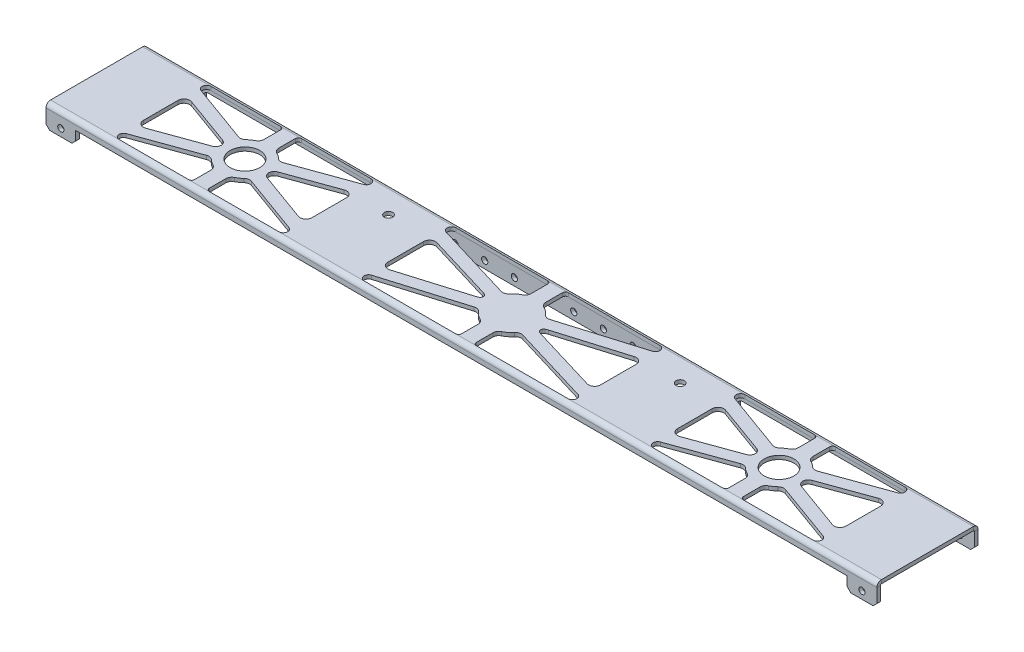
from build123d import *

# Parameters (mm, degrees)
SKETCH1_W                = 711.2
SKETCH1_H                = 78.74
BOSS_EXTRUDE1_DEPTH      = 3.175
EDGE_FLANGE1_DEPTH       = 711.2
EDGE_FLANGE2_DEPTH       = 711.2
SKETCH14_R               = 2.667
UPPER_FLANGE_HP_DEPTH    = 717.630616581
CUT_EXTRUDE7_START       = -3.175
CUT_EXTRUDE7_OUTLINE_W   = 660.4
CUT_EXTRUDE7_OUTLINE_H   = 20.875
CUT_EXTRUDE7_OUTLINE_R   = 2.667
CUT_EXTRUDE7_DEPTH       = 3.937
CHAMFER1_SIZE            = 3.175
SKETCH22_W               = 3.175
SKETCH22_H               = 11.938
BOSS_EXTRUDE2_DEPTH      = 660.4
SKETCH23_W               = 660.4
SKETCH23_H               = 7.9375
CUT_EXTRUDE8_DEPTH       = 127
SKETCH24_R               = 12.7
CUT_EXTRUDE9_DEPTH       = 717.165443144
SKETCH25_R               = 3.571875
CUT_EXTRUDE10_DEPTH      = 254
SKETCH27_W               = 152.4
SKETCH27_H               = 12.100443779
SKETCH27_R               = 2.667
CUT_EXTRUDE12_DEPTH      = 10.16
FILLET1_R                = 5.08
CHAMFER2_SIZE            = 2.54
CUT_EXTRUDE13_DEPTH      = 717.24285604
CUT_EXTRUDE13_DEPTH_BACK = 717.24285604
FILLET10_R               = 3.81
CUT_EXTRUDE14_START      = -10.16
CUT_EXTRUDE14_DEPTH      = 10.16
FILLET11_R               = 5.08
FILLET12_R               = 12.7
FILLET13_R               = 2.54
FILLET14_R               = 5.08
FILLET15_R               = 2.54


# Read off the part's stored shape, not the designer's step: Cut-Extrude7
# Sheet-metal steps are written as plain solids
with BuildPart() as part:
    # Sketch1 → Boss-Extrude1 (new body)
    with BuildSketch(Plane(origin=(0, 0, 0), x_dir=(1, 0, 0), z_dir=(0, 1, 0))):
        with Locations((355.6, 39.37)):
            Rectangle(SKETCH1_W, SKETCH1_H)
    extrude(amount=BOSS_EXTRUDE1_DEPTH)

    # Edge-Flange1 section (across the edge) → Edge-Flange1 (add)
    with BuildSketch(Plane(origin=(711.2, 0, 0.762), x_dir=(0, 0, -1), z_dir=(-1, 0, 0))):
        with BuildLine():
            Line((-3.175, 0.762), (-3.175, 15.875))
            Line((-3.175, 15.875), (0, 15.875))
            Line((0, 15.875), (0, 0.762))
            ThreePointArc((0, 0.762), (0.223184633, 0.223184633), (0.762, 0))
            Line((0.762, 0), (0.762, -3.175))
            ThreePointArc((0.762, -3.175), (-2.021879398, -2.021879398), (-3.175, 0.762))
        make_face()
    extrude(amount=EDGE_FLANGE1_DEPTH)

    # Edge-Flange2 section (across the edge) → Edge-Flange2 (add)
    with BuildSketch(Plane(origin=(0, 0, -79.502), x_dir=(0, 0, 1), z_dir=(1, 0, 0))):
        with BuildLine():
            Line((-3.175, 0.762), (-3.175, 15.875))
            Line((-3.175, 15.875), (0, 15.875))
            Line((0, 15.875), (0, 0.762))
            ThreePointArc((0, 0.762), (0.223184633, 0.223184633), (0.762, 0))
            Line((0.762, 0), (0.762, -3.175))
            ThreePointArc((0.762, -3.175), (-2.021879398, -2.021879398), (-3.175, 0.762))
        make_face()
    extrude(amount=EDGE_FLANGE2_DEPTH)

    # Sketch14 → upper flange HP (cut, through all)
    with BuildSketch(Plane(origin=(0, 0, -82.677), x_dir=(-1, 0, 0), z_dir=(0, 0, -1))):
        with Locations(Location((-12.7, -9.525, 0), (0, 0, 90))):
            Circle(SKETCH14_R)
        with Locations(Location((-38.1, -9.525, 0), (0, 0, 90))):
            Circle(SKETCH14_R)
        with Locations(Location((-63.5, -9.525, 0), (0, 0, 90))):
            Circle(SKETCH14_R)
        with Locations(Location((-88.9, -9.525, 0), (0, 0, 90))):
            Circle(SKETCH14_R)
        with Locations(Location((-114.3, -9.525, 0), (0, 0, 90))):
            Circle(SKETCH14_R)
        with Locations(Location((-139.7, -9.525, 0), (0, 0, 90))):
            Circle(SKETCH14_R)
        with Locations(Location((-165.1, -9.525, 0), (0, 0, 90))):
            Circle(SKETCH14_R)
        with Locations(Location((-190.5, -9.525, 0), (0, 0, 90))):
            Circle(SKETCH14_R)
        with Locations(Location((-215.9, -9.525, 0), (0, 0, 90))):
            Circle(SKETCH14_R)
        with Locations(Location((-241.3, -9.525, 0), (0, 0, 90))):
            Circle(SKETCH14_R)
        with Locations(Location((-266.7, -9.525, 0), (0, 0, 90))):
            Circle(SKETCH14_R)
        with Locations(Location((-292.1, -9.525, 0), (0, 0, 90))):
            Circle(SKETCH14_R)
        with Locations(Location((-317.5, -9.525, 0), (0, 0, 90))):
            Circle(SKETCH14_R)
        with Locations(Location((-342.9, -9.525, 0), (0, 0, 90))):
            Circle(SKETCH14_R)
        with Locations(Location((-368.3, -9.525, 0), (0, 0, 90))):
            Circle(SKETCH14_R)
        with Locations(Location((-393.7, -9.525, 0), (0, 0, 90))):
            Circle(SKETCH14_R)
        with Locations(Location((-419.1, -9.525, 0), (0, 0, 90))):
            Circle(SKETCH14_R)
        with Locations(Location((-444.5, -9.525, 0), (0, 0, 90))):
            Circle(SKETCH14_R)
        with Locations(Location((-469.9, -9.525, 0), (0, 0, 90))):
            Circle(SKETCH14_R)
        with Locations(Location((-495.3, -9.525, 0), (0, 0, 90))):
            Circle(SKETCH14_R)
        with Locations(Location((-520.7, -9.525, 0), (0, 0, 90))):
            Circle(SKETCH14_R)
        with Locations(Location((-546.1, -9.525, 0), (0, 0, 90))):
            Circle(SKETCH14_R)
        with Locations(Location((-571.5, -9.525, 0), (0, 0, 90))):
            Circle(SKETCH14_R)
        with Locations(Location((-596.9, -9.525, 0), (0, 0, 90))):
            Circle(SKETCH14_R)
        with Locations(Location((-622.3, -9.525, 0), (0, 0, 90))):
            Circle(SKETCH14_R)
        with Locations(Location((-647.7, -9.525, 0), (0, 0, 90))):
            Circle(SKETCH14_R)
        with Locations(Location((-673.1, -9.525, 0), (0, 0, 90))):
            Circle(SKETCH14_R)
        with Locations(Location((-698.5, -9.525, 0), (0, 0, 90))):
            Circle(SKETCH14_R)
        with Locations((-723.9, -9.525)):
            Circle(SKETCH14_R)
        with Locations((-749.3, -9.525)):
            Circle(SKETCH14_R)
        with Locations((-774.7, -9.525)):
            Circle(SKETCH14_R)
        with Locations((-800.1, -9.525)):
            Circle(SKETCH14_R)
    extrude(amount=-UPPER_FLANGE_HP_DEPTH, mode=Mode.SUBTRACT)

    # Cut-Extrude7 outline → Cut-Extrude7 (cut)
    with BuildSketch(Plane(origin=(0, 0, 0.762), x_dir=(-1, 0, 0), z_dir=(0, 0, -1)).offset(CUT_EXTRUDE7_START)):
        with Locations((-355.6, -5.4375)):
            Rectangle(CUT_EXTRUDE7_OUTLINE_W, CUT_EXTRUDE7_OUTLINE_H)
        with Locations((-673.1, -9.525)):
            Circle(CUT_EXTRUDE7_OUTLINE_R, mode=Mode.SUBTRACT)
        with Locations((-647.7, -9.525)):
            Circle(CUT_EXTRUDE7_OUTLINE_R, mode=Mode.SUBTRACT)
        with Locations((-622.3, -9.525)):
            Circle(CUT_EXTRUDE7_OUTLINE_R, mode=Mode.SUBTRACT)
        with Locations((-596.9, -9.525)):
            Circle(CUT_EXTRUDE7_OUTLINE_R, mode=Mode.SUBTRACT)
        with Locations((-571.5, -9.525)):
            Circle(CUT_EXTRUDE7_OUTLINE_R, mode=Mode.SUBTRACT)
        with Locations((-546.1, -9.525)):
            Circle(CUT_EXTRUDE7_OUTLINE_R, mode=Mode.SUBTRACT)
        with Locations((-520.7, -9.525)):
            Circle(CUT_EXTRUDE7_OUTLINE_R, mode=Mode.SUBTRACT)
        with Locations((-495.3, -9.525)):
            Circle(CUT_EXTRUDE7_OUTLINE_R, mode=Mode.SUBTRACT)
        with Locations((-469.9, -9.525)):
            Circle(CUT_EXTRUDE7_OUTLINE_R, mode=Mode.SUBTRACT)
        with Locations((-444.5, -9.525)):
            Circle(CUT_EXTRUDE7_OUTLINE_R, mode=Mode.SUBTRACT)
        with Locations((-419.1, -9.525)):
            Circle(CUT_EXTRUDE7_OUTLINE_R, mode=Mode.SUBTRACT)
        with Locations((-393.7, -9.525)):
            Circle(CUT_EXTRUDE7_OUTLINE_R, mode=Mode.SUBTRACT)
        with Locations((-368.3, -9.525)):
            Circle(CUT_EXTRUDE7_OUTLINE_R, mode=Mode.SUBTRACT)
        with Locations((-342.9, -9.525)):
            Circle(CUT_EXTRUDE7_OUTLINE_R, mode=Mode.SUBTRACT)
        with Locations((-317.5, -9.525)):
            Circle(CUT_EXTRUDE7_OUTLINE_R, mode=Mode.SUBTRACT)
        with Locations((-292.1, -9.525)):
            Circle(CUT_EXTRUDE7_OUTLINE_R, mode=Mode.SUBTRACT)
        with Locations((-266.7, -9.525)):
            Circle(CUT_EXTRUDE7_OUTLINE_R, mode=Mode.SUBTRACT)
        with Locations((-241.3, -9.525)):
            Circle(CUT_EXTRUDE7_OUTLINE_R, mode=Mode.SUBTRACT)
        with Locations((-215.9, -9.525)):
            Circle(CUT_EXTRUDE7_OUTLINE_R, mode=Mode.SUBTRACT)
        with Locations((-190.5, -9.525)):
            Circle(CUT_EXTRUDE7_OUTLINE_R, mode=Mode.SUBTRACT)
        with Locations((-165.1, -9.525)):
            Circle(CUT_EXTRUDE7_OUTLINE_R, mode=Mode.SUBTRACT)
        with Locations((-139.7, -9.525)):
            Circle(CUT_EXTRUDE7_OUTLINE_R, mode=Mode.SUBTRACT)
        with Locations((-114.3, -9.525)):
            Circle(CUT_EXTRUDE7_OUTLINE_R, mode=Mode.SUBTRACT)
        with Locations((-88.9, -9.525)):
            Circle(CUT_EXTRUDE7_OUTLINE_R, mode=Mode.SUBTRACT)
        with Locations((-63.5, -9.525)):
            Circle(CUT_EXTRUDE7_OUTLINE_R, mode=Mode.SUBTRACT)
        with Locations((-38.1, -9.525)):
            Circle(CUT_EXTRUDE7_OUTLINE_R, mode=Mode.SUBTRACT)
    extrude(amount=CUT_EXTRUDE7_DEPTH, mode=Mode.SUBTRACT)

    # Chamfer1
    chamfer1_edges = [part.edges().sort_by_distance(p)[0] for p in [
        (711.2, -15.875, 2.3495),
        (0, -15.875, 2.3495),
        (25.4, -15.875, 2.3495),
        (685.8, -15.875, 2.3495),
        (0, -15.875, -81.0895),
        (711.2, -15.875, -81.0895),
    ]]
    chamfer(chamfer1_edges, length=CHAMFER1_SIZE)

    # Sketch22 → Boss-Extrude2 (add)
    with BuildSketch(Plane.ZY.offset(-685.8)):
        with BuildLine():
            ThreePointArc((0, 0), (0.538815367, -0.223184633), (0.762, -0.762))
            Line((0.762, -0.762), (3.937, -0.762))
            ThreePointArc((3.937, -0.762), (2.783879398, 2.021879398), (0, 3.175))
            Line((0, 3.175), (0, 0))
        make_face()
        with Locations((2.3495, -6.731)):
            Rectangle(SKETCH22_W, SKETCH22_H)
    extrude(amount=BOSS_EXTRUDE2_DEPTH)

    # Sketch23 → Cut-Extrude8 (cut)
    with BuildSketch(Plane(origin=(0, 0, 0.762), x_dir=(-1, 0, 0), z_dir=(0, 0, -1))):
        with Locations((-355.6, -8.73125)):
            Rectangle(SKETCH23_W, SKETCH23_H)
    extrude(amount=-CUT_EXTRUDE8_DEPTH, mode=Mode.SUBTRACT)

    # Sketch24 → Cut-Extrude9 (cut, through all)
    with BuildSketch(Plane(origin=(0, 0, 0), x_dir=(-1, 0, 0), z_dir=(0, -1, 0))):
        with Locations(Location((-584.2, 39.37, 0), (0, 0, 90))):
            Circle(SKETCH24_R)
        with Locations(Location((-127, 39.37, 0), (0, 0, 90))):
            Circle(SKETCH24_R)
    extrude(amount=-CUT_EXTRUDE9_DEPTH, mode=Mode.SUBTRACT)

    # Sketch25 → Cut-Extrude10 (cut)
    with BuildSketch(Plane.XZ):
        with Locations(Location((479.4, -59.502, 0), (0, 0, 270))):
            Circle(SKETCH25_R)
        with Locations(Location((229.79920635, -59.502, 0), (0, 0, 270))):
            Circle(SKETCH25_R)
    extrude(amount=-CUT_EXTRUDE10_DEPTH, mode=Mode.SUBTRACT)

    # Sketch27 → Cut-Extrude12 (cut)
    # profile 1 of 2: a face of its own
    with BuildSketch(Plane(origin=(0, 0, -82.677), x_dir=(-1, 0, 0), z_dir=(0, 0, -1))):
        with Locations((-584.2, -9.824778111)):
            Rectangle(SKETCH27_W, SKETCH27_H)
        with Locations((-647.7, -9.525)):
            Circle(SKETCH27_R, mode=Mode.SUBTRACT)
        with Locations((-622.3, -9.525)):
            Circle(SKETCH27_R, mode=Mode.SUBTRACT)
        with Locations((-596.9, -9.525)):
            Circle(SKETCH27_R, mode=Mode.SUBTRACT)
        with Locations((-571.5, -9.525)):
            Circle(SKETCH27_R, mode=Mode.SUBTRACT)
        with Locations((-546.1, -9.525)):
            Circle(SKETCH27_R, mode=Mode.SUBTRACT)
        with Locations((-520.7, -9.525)):
            Circle(SKETCH27_R, mode=Mode.SUBTRACT)
    # profile 2 of 2: a face of its own
    with BuildSketch(Plane(origin=(0, 0, -82.677), x_dir=(-1, 0, 0), z_dir=(0, 0, -1))):
        with Locations((-127, -9.824778111)):
            Rectangle(SKETCH27_W, SKETCH27_H)
    extrude(amount=-CUT_EXTRUDE12_DEPTH, mode=Mode.SUBTRACT)

    # Fillet1
    fillet1_edges = [part.edges().sort_by_distance(p)[0] for p in [
        (660.4, -3.774556221, -81.0895),
        (508, -3.774556221, -81.0895),
        (203.2, -3.774556221, -81.0895),
        (50.8, -3.774556221, -81.0895),
    ]]
    fillet(fillet1_edges, radius=FILLET1_R)

    # Chamfer2
    chamfer2_edges = [part.edges().sort_by_distance(p)[0] for p in [
        (50.8, -15.875, -81.0895),
        (203.2, -15.875, -81.0895),
        (660.4, -15.875, -81.0895),
        (508, -15.875, -81.0895),
    ]]
    chamfer(chamfer2_edges, length=CHAMFER2_SIZE)

    # Sketch29 → Cut-Extrude13 (cut, two sides: drawn at the far end of the back side and taken through both)
    with BuildSketch(Plane(origin=(0, 3.175, 0), x_dir=(1, 0, 0), z_dir=(0, 1, 0)).offset(-CUT_EXTRUDE13_DEPTH_BACK)):
        with BuildLine():
            Line((338.22619972, 28.831809271), (242.49920635, 0))
            Line((242.49920635, 0), (349.25, 0))
            Line((349.25, 0), (349.25, 20.067671125))
            ThreePointArc((349.25, 20.067671125), (342.954557964, 23.464177302), (338.22619972, 28.831809271))
        make_face()
        with BuildLine():
            Line((349.25, 78.74), (242.49920635, 78.74))
            Line((242.49920635, 78.74), (338.22619972, 49.908190729))
            ThreePointArc((338.22619972, 49.908190729), (342.954557964, 55.275822698), (349.25, 58.672328875))
            Line((349.25, 58.672328875), (349.25, 78.74))
        make_face()
        with BuildLine():
            Line((111.005334269, 26.837120516), (36.90079357, 0))
            Line((36.90079357, 0), (120.65, 0))
            Line((120.65, 0), (120.65, 20.067671125))
            ThreePointArc((120.65, 20.067671125), (115.326209574, 22.737952108), (111.005334269, 26.837120516))
        make_face()
        with BuildLine():
            Line((133.35, 20.067671125), (133.35, 0))
            Line((133.35, 0), (217.09920635, 0))
            Line((217.09920635, 0), (142.994665731, 26.837120516))
            ThreePointArc((142.994665731, 26.837120516), (138.673790426, 22.737952108), (133.35, 20.067671125))
        make_face()
        with BuildLine():
            Line((217.09920635, 78.74), (133.35, 78.74))
            Line((133.35, 78.74), (133.35, 58.672328875))
            ThreePointArc((133.35, 58.672328875), (138.673790426, 56.002047892), (142.994665731, 51.902879484))
            Line((142.994665731, 51.902879484), (217.09920635, 78.74))
        make_face()
        with BuildLine():
            Line((120.65, 78.74), (36.90079357, 78.74))
            Line((36.90079357, 78.74), (111.005334269, 51.902879484))
            ThreePointArc((111.005334269, 51.902879484), (115.326209574, 56.002047892), (120.65, 58.672328875))
            Line((120.65, 58.672328875), (120.65, 78.74))
        make_face()
        with BuildLine():
            Line((372.97380028, 49.908190729), (468.70079365, 78.74))
            Line((468.70079365, 78.74), (361.95, 78.74))
            Line((361.95, 78.74), (361.95, 58.672328875))
            ThreePointArc((361.95, 58.672328875), (368.245442036, 55.275822698), (372.97380028, 49.908190729))
        make_face()
        with BuildLine():
            Line((494.10079365, 0), (577.85, 0))
            Line((577.85, 0), (577.85, 20.067671125))
            ThreePointArc((577.85, 20.067671125), (572.526209574, 22.737952108), (568.205334269, 26.837120516))
            Line((568.205334269, 26.837120516), (494.10079365, 0))
        make_face()
        with BuildLine():
            Line((590.55, 20.067671125), (590.55, 0))
            Line((590.55, 0), (674.29920643, 0))
            Line((674.29920643, 0), (600.194665731, 26.837120516))
            ThreePointArc((600.194665731, 26.837120516), (595.873790426, 22.737952108), (590.55, 20.067671125))
        make_face()
        with BuildLine():
            Line((674.29920643, 78.74), (590.55, 78.74))
            Line((590.55, 78.74), (590.55, 58.672328875))
            ThreePointArc((590.55, 58.672328875), (595.873790426, 56.002047892), (600.194665731, 51.902879484))
            Line((600.194665731, 51.902879484), (674.29920643, 78.74))
        make_face()
        with BuildLine():
            Line((577.85, 58.672328875), (577.85, 78.74))
            Line((577.85, 78.74), (494.10079365, 78.74))
            Line((494.10079365, 78.74), (568.205334269, 51.902879484))
            ThreePointArc((568.205334269, 51.902879484), (572.526209574, 56.002047892), (577.85, 58.672328875))
        make_face()
        with BuildLine():
            Line((468.70079365, 0), (372.97380028, 28.831809271))
            ThreePointArc((372.97380028, 28.831809271), (368.245442036, 23.464177302), (361.95, 20.067671125))
            Line((361.95, 20.067671125), (361.95, 0))
            Line((361.95, 0), (468.70079365, 0))
        make_face()
    extrude(amount=CUT_EXTRUDE13_DEPTH + CUT_EXTRUDE13_DEPTH_BACK, mode=Mode.SUBTRACT)

    # Fillet10
    fillet10_edges = [part.edges().sort_by_distance(p)[0] for p in [
        (242.49920635, 1.5875, -78.74),
        (468.70079365, 1.5875, 0),
        (468.70079365, 1.5875, -78.74),
        (494.10079365, 1.5875, -78.74),
        (217.09920635, 1.5875, -78.74),
        (217.09920635, 1.5875, 0),
        (36.90079357, 1.5875, 0),
        (242.49920635, 1.5875, 0),
        (674.29920643, 1.5875, -78.74),
        (674.29920643, 1.5875, 0),
        (494.10079365, 1.5875, 0),
        (36.90079357, 1.5875, -78.74),
    ]]
    fillet(fillet10_edges, radius=FILLET10_R)

    # Sketch30 → Cut-Extrude14 (cut)
    with BuildSketch(Plane(origin=(0, 3.175, 0), x_dir=(1, 0, 0), z_dir=(0, 1, 0)).offset(CUT_EXTRUDE14_START)):
        with BuildLine():
            Line((199.142324219, 17.308866397), (199.142324219, 61.431133603))
            Line((199.142324219, 61.431133603), (147.066186859, 42.571647226))
            ThreePointArc((147.066186859, 42.571647226), (147.32, 39.37), (147.066186859, 36.168352774))
            Line((147.066186859, 36.168352774), (199.142324219, 17.308866397))
        make_face()
        with BuildLine():
            ThreePointArc((335.296145106, 40.179861994), (335.28, 39.37), (335.296145106, 38.560138006))
            Line((335.296145106, 38.560138006), (264.591025914, 17.264613731))
            Line((264.591025914, 17.264613731), (264.591025914, 61.475386269))
            Line((264.591025914, 61.475386269), (335.296145106, 40.179861994))
        make_face()
        with BuildLine():
            ThreePointArc((375.903854894, 38.560138006), (375.92, 39.37), (375.903854894, 40.179861994))
            Line((375.903854894, 40.179861994), (446.608974086, 61.475386269))
            Line((446.608974086, 61.475386269), (446.608974086, 17.264613731))
            Line((446.608974086, 17.264613731), (375.903854894, 38.560138006))
        make_face()
        with BuildLine():
            Line((512.046367011, 17.304770901), (564.133813141, 36.168352774))
            ThreePointArc((564.133813141, 36.168352774), (563.88, 39.37), (564.133813141, 42.571647226))
            Line((564.133813141, 42.571647226), (512.011095825, 61.448002636))
            Line((512.011095825, 61.448002636), (512.046367011, 17.304770901))
        make_face()
        with BuildLine():
            ThreePointArc((604.266186859, 36.168352774), (604.52, 39.37), (604.266186859, 42.571647226))
            Line((604.266186859, 42.571647226), (656.388904233, 61.448002636))
            Line((656.388904233, 61.448002636), (656.353633047, 17.304770901))
            Line((656.353633047, 17.304770901), (604.266186859, 36.168352774))
        make_face()
        with BuildLine():
            Line((54.857675723, 61.431133604), (106.933813141, 42.571647226))
            ThreePointArc((106.933813141, 42.571647226), (106.68, 39.37), (106.933813141, 36.168352774))
            Line((106.933813141, 36.168352774), (54.857675723, 17.308866396))
            Line((54.857675723, 17.308866396), (54.857675723, 61.431133604))
        make_face()
    extrude(amount=CUT_EXTRUDE14_DEPTH, mode=Mode.SUBTRACT)

    # Fillet11
    # the kernel refuses this fillet: 5.08 mm, written as the material it adds along each edge
    with BuildSketch(Plane(origin=(106.933813141, 0, -42.571647226), x_dir=(-0.9402408036719843, 0, -0.3405102511089219), z_dir=(0, 1, 0))) as fillet11_piece_1:
        with BuildLine():
            CenterArc((3.831555696, 5.08), FILLET11_R, 200.517233147, 69.482766853)
            ThreePointArc((-0.926203715, 3.299515407), (-0.393418231, 1.669318525), (0, 0))
            Line((0, 0), (3.831555696, 0))
        make_face()
    extrude(amount=3.175)
    with BuildSketch(Plane(origin=(106.933813141, 0, -36.168352774), x_dir=(-0.9402408036719846, 0, 0.340510251108921), z_dir=(0, 1, 0))) as fillet11_piece_2:
        with BuildLine():
            CenterArc((3.831555696, -5.08), FILLET11_R, 90, 69.482766853)
            ThreePointArc((-0.926203715, -3.299515407), (-0.393418231, -1.669318525), (0, 0))
            Line((0, 0), (3.831555696, 0))
        make_face()
    extrude(amount=3.175)
    with BuildSketch(Plane(origin=(604.266186859, 0, -36.168352774), x_dir=(0.07372652031943779, 0, -0.9972784968109898), z_dir=(0, 1, 0))) as fillet11_piece_3:
        with BuildLine():
            CenterArc((3.855428548, -5.061905744), FILLET11_R, 94.837323485, 69.482766853)
            Line((-1.035527234, -3.688970371), (0, 0))
            ThreePointArc((0, 0), (1.713523799, -0.072377024), (3.427047598, 0))
        make_face()
    extrude(amount=3.175)
    with BuildSketch(Plane(origin=(604.266186859, 0, -42.571647226), x_dir=(0.07372652031943824, 0, 0.9972784968109898), z_dir=(0, 1, 0))) as fillet11_piece_4:
        with BuildLine():
            CenterArc((3.855428548, 5.061905744), FILLET11_R, 195.679909662, 69.482766853)
            Line((-1.035527234, 3.688970371), (0, 0))
            ThreePointArc((0, 0), (1.713523799, 0.072377024), (3.427047598, 0))
        make_face()
    extrude(amount=3.175)
    with BuildSketch(Plane(origin=(564.133813141, 0, -42.571647226), x_dir=(-0.07372652035756005, 0, 0.9972784968081715), z_dir=(0, 1, 0)), Plane(origin=(147.066186859, 0, -36.168352774), x_dir=(0.0737265203575437, 0, -0.9972784968081727), z_dir=(0, 1, 0))) as fillet11_piece_5:
        with BuildLine():
            CenterArc((3.855428547, -5.061905744), FILLET11_R, 94.837323484, 69.482766837)
            Line((-1.035527235, -3.68897037), (0, 0))
            ThreePointArc((0, 0), (1.713523799, -0.072377024), (3.427047597, 0))
        make_face()
    extrude(amount=3.175)
    with BuildSketch(Plane(origin=(564.133813141, 0, -36.168352774), x_dir=(-0.9402408035542927, 0, 0.34051025143390035), z_dir=(0, 1, 0)), Plane(origin=(147.066186859, 0, -42.571647226), x_dir=(0.9402408035542937, 0, -0.340510251433897), z_dir=(0, 1, 0))) as fillet11_piece_6:
        with BuildLine():
            CenterArc((3.831555695, -5.08), FILLET11_R, 90, 69.482766837)
            ThreePointArc((-0.926203716, -3.299515406), (-0.393418231, -1.669318525), (0, 0))
            Line((0, 0), (3.831555695, 0))
        make_face()
    extrude(amount=3.175)
    with BuildSketch(Plane(origin=(349.25, 3.175, -58.672328875), x_dir=(-0.9240342753920577, 0, 0.38230963615984737), z_dir=(0, -1, 0)), Plane(origin=(577.85, 3.175, -58.672328875), x_dir=(-0.9240342753920543, 0, 0.38230963615985536), z_dir=(0, -1, 0)), Plane(origin=(120.65, 0, -20.067671125), x_dir=(-0.9240342753920578, 0, -0.38230963615984703), z_dir=(0, 1, 0)), Plane(origin=(120.65, 3.175, -58.672328875), x_dir=(-0.9240342753920568, 0, 0.38230963615984936), z_dir=(0, -1, 0))) as fillet11_piece_7:
        with BuildLine():
            CenterArc((3.401659531, 5.065919916), FILLET11_R, 202.476820407, 63.25631605)
            Line((-1.292434588, 3.123786965), (0, 0))
            ThreePointArc((0, 0), (1.511848681, 0.056320335), (3.023697361, 0))
        make_face()
    extrude(amount=3.175)
    with BuildSketch(Plane(origin=(338.22619972, 3.175, -49.908190729), x_dir=(-0.9575126706850127, 0, -0.28839120215022984), z_dir=(0, -1, 0)), Plane(origin=(338.22619972, 0, -28.831809271), x_dir=(-0.9575126706850126, 0, 0.2883912021502296), z_dir=(0, 1, 0))) as fillet11_piece_8:
        with BuildLine():
            CenterArc((3.604729132, 5.08), FILLET11_R, 203.578178478, 66.421821522)
            ThreePointArc((-1.051167774, 3.048), (-0.465035318, 1.544881465), (0, 0))
            Line((0, 0), (3.604729132, 0))
        make_face()
    extrude(amount=3.175)
    with BuildSketch(Plane(origin=(361.95, 3.175, -20.067671125), x_dir=(0, 0, 1), z_dir=(0, -1, 0)), Plane(origin=(133.35, 0, -58.672328875), x_dir=(0, 0, -1), z_dir=(0, 1, 0)), Plane(origin=(133.35, 3.175, -20.067671125), x_dir=(0, 0, 1), z_dir=(0, -1, 0)), Plane(origin=(590.55, 3.175, -20.067671125), x_dir=(0, 0, 1), z_dir=(0, -1, 0))) as fillet11_piece_9:
        with BuildLine():
            CenterArc((3.380596421, -5.08), FILLET11_R, 90, 63.25631605)
            ThreePointArc((-1.155988638, -2.794), (-0.525952399, -1.418531807), (0, 0))
            Line((0, 0), (3.380596421, 0))
        make_face()
    extrude(amount=3.175)
    with BuildSketch(Plane(origin=(372.97380028, 3.175, -28.831809271), x_dir=(-0.5848091639445875, 0, 0.811170907864941), z_dir=(0, -1, 0)), Plane(origin=(372.97380028, 0, -49.908190729), x_dir=(-0.5848091639445875, 0, -0.811170907864941), z_dir=(0, 1, 0))) as fillet11_piece_10:
        with BuildLine():
            CenterArc((3.62718872, -5.063987964), FILLET11_R, 94.550333146, 66.421821522)
            Line((-1.1752413, -3.407767598), (0, 0))
            ThreePointArc((0, 0), (1.612083876, -0.064048144), (3.224167752, 0))
        make_face()
    extrude(amount=3.175)
    with BuildSketch(Plane(origin=(361.95, 3.175, -58.672328875), x_dir=(0, 0, -1), z_dir=(0, -1, 0)), Plane(origin=(590.55, 3.175, -58.672328875), x_dir=(0, 0, -1), z_dir=(0, -1, 0))) as fillet11_piece_11:
        with BuildLine():
            CenterArc((3.380596421, 5.08), FILLET11_R, 206.74368395, 63.25631605)
            ThreePointArc((-1.155988638, 2.794), (-0.525952399, 1.418531807), (0, 0))
            Line((0, 0), (3.380596421, 0))
        make_face()
    extrude(amount=3.175)
    with BuildSketch(Plane(origin=(568.205334269, 3.175, -51.902879484), x_dir=(-0.9402408035542952, 0, -0.34051025143389363), z_dir=(0, -1, 0)), Plane(origin=(568.205334269, 0, -26.837120516), x_dir=(-0.940240803554293, 0, 0.34051025143389974), z_dir=(0, 1, 0))) as fillet11_piece_12:
        with BuildLine():
            CenterArc((3.382769705, 5.08), FILLET11_R, 206.712308556, 63.287691444)
            ThreePointArc((-1.155066497, 2.796484594), (-0.525411471, 1.419770797), (0, 0))
            Line((0, 0), (3.382769705, 0))
        make_face()
    extrude(amount=3.175)
    with BuildSketch(Plane(origin=(142.994665731, 3.175, -51.902879484), x_dir=(-0.6736662366069149, 0, -0.7390357242081577), z_dir=(0, -1, 0))) as fillet11_piece_13:
        with BuildLine():
            CenterArc((3.403846355, 5.065901782), FILLET11_R, 202.442696888, 63.287691444)
            Line((-1.291403603, 3.126564826), (0, 0))
            ThreePointArc((0, 0), (1.512820602, 0.056392872), (3.025641205, 0))
        make_face()
    extrude(amount=3.175)
    with BuildSketch(Plane(origin=(142.994665731, 3.175, -26.837120516), x_dir=(-0.6736662366069162, 0, 0.7390357242081566), z_dir=(0, -1, 0))) as fillet11_piece_14:
        with BuildLine():
            CenterArc((3.403846355, -5.065901782), FILLET11_R, 94.269611668, 63.287691444)
            Line((-1.291403603, -3.126564826), (0, 0))
            ThreePointArc((0, 0), (1.512820602, -0.056392872), (3.025641205, 0))
        make_face()
    extrude(amount=3.175)
    with BuildSketch(Plane(origin=(111.005334269, 3.175, -26.837120516), x_dir=(-0.9402408036719839, 0, 0.34051025110892286), z_dir=(0, -1, 0))) as fillet11_piece_15:
        with BuildLine():
            CenterArc((3.382769703, -5.08), FILLET11_R, 90, 63.287691427)
            ThreePointArc((-1.155066497, -2.796484593), (-0.525411471, -1.419770797), (0, 0))
            Line((0, 0), (3.382769703, 0))
        make_face()
    extrude(amount=3.175)
    with BuildSketch(Plane(origin=(349.25, 3.175, -20.067671125), x_dir=(-0.9240342753920552, 0, -0.3823096361598533), z_dir=(0, -1, 0)), Plane(origin=(577.85, 3.175, -20.067671125), x_dir=(-0.9240342753920523, 0, -0.38230963615986036), z_dir=(0, -1, 0))) as fillet11_piece_16:
        with BuildLine():
            CenterArc((3.401659531, -5.065919916), FILLET11_R, 94.266863543, 63.25631605)
            Line((-1.292434588, -3.123786965), (0, 0))
            ThreePointArc((0, 0), (1.511848681, -0.056320335), (3.023697361, 0))
        make_face()
    extrude(amount=3.175)
    with BuildSketch(Plane(origin=(600.194665731, 0, -51.902879484), x_dir=(-0.673666236587871, 0, -0.7390357242255171), z_dir=(0, 1, 0)), Plane(origin=(600.194665731, 3.175, -26.837120516), x_dir=(-0.6736662365878722, 0, 0.7390357242255161), z_dir=(0, -1, 0))) as fillet11_piece_17:
        with BuildLine():
            CenterArc((3.403846354, -5.065901782), FILLET11_R, 94.269611666, 63.287691427)
            Line((-1.291403603, -3.126564824), (0, 0))
            ThreePointArc((0, 0), (1.512820602, -0.056392872), (3.025641204, 0))
        make_face()
    extrude(amount=3.175)
    with BuildSketch(Plane(origin=(111.005334269, 3.175, -51.902879484), x_dir=(-0.9402408036719846, 0, -0.34051025110892097), z_dir=(0, -1, 0))) as fillet11_piece_18:
        with BuildLine():
            CenterArc((3.382769703, 5.08), FILLET11_R, 206.712308573, 63.287691427)
            ThreePointArc((-1.155066497, 2.796484593), (-0.525411471, 1.419770797), (0, 0))
            Line((0, 0), (3.382769703, 0))
        make_face()
    extrude(amount=3.175)

    # Fillet12
    # the kernel refuses this fillet: 12.7 mm, written as the material it adds along each edge
    with BuildSketch(Plane(origin=(375.903854894, 0, -38.560138006), x_dir=(-0.11782471303731988, 0, -0.9930344087682325), z_dir=(0, 1, 0))) as fillet12_piece_1:
        with BuildLine():
            CenterArc((8.390856346, -12.541877989), FILLET12_R, 99.050729103, 57.421029607)
            Line((-3.253309065, -7.472024749), (0, 0))
            ThreePointArc((0, 0), (3.196516703, -0.252995217), (6.393033406, 0))
        make_face()
    extrude(amount=3.175)
    with BuildSketch(Plane(origin=(375.903854894, 0, -40.179861994), x_dir=(0.9575126706850117, 0, -0.2883912021502323), z_dir=(0, 1, 0)), Plane(origin=(335.296145106, 0, -38.560138006), x_dir=(-0.9575126706850119, 0, 0.2883912021502317), z_dir=(0, 1, 0))) as fillet12_piece_2:
        with BuildLine():
            CenterArc((8.149550523, -12.7), FILLET12_R, 90, 57.421029607)
            ThreePointArc((-2.552105601, -5.861538462), (-1.044090741, -3.031765185), (0, 0))
            Line((0, 0), (8.149550523, 0))
        make_face()
    extrude(amount=3.175)
    with BuildSketch(Plane(origin=(335.296145106, 0, -40.179861994), x_dir=(-0.9575126706850118, 0, -0.288391202150232), z_dir=(0, 1, 0))) as fillet12_piece_3:
        with BuildLine():
            CenterArc((8.149550523, 12.7), FILLET12_R, 212.578970393, 57.421029607)
            ThreePointArc((-2.552105601, 5.861538462), (-1.044090741, 3.031765185), (0, 0))
            Line((0, 0), (8.149550523, 0))
        make_face()
    extrude(amount=3.175)

    # Fillet13
    fillet13_edges = [part.edges().sort_by_distance(p)[0] for p in [
        (378.40954385, 1.5875, -39.37),
        (332.79045615, 1.5875, -39.37),
    ]]
    fillet(fillet13_edges, radius=FILLET13_R)

    # Fillet14
    fillet14_edges = [part.edges().sort_by_distance(p)[0] for p in [
        (54.857675723, 1.5875, -17.308866396),
        (54.857675723, 1.5875, -61.431133604),
        (656.353633047, 1.5875, -17.304770901),
        (656.388904233, 1.5875, -61.448002636),
        (512.046367011, 1.5875, -17.304770901),
        (512.011095825, 1.5875, -61.448002636),
        (446.608974086, 1.5875, -61.475386269),
        (446.608974086, 1.5875, -17.264613731),
        (264.591025914, 1.5875, -17.264613731),
        (264.591025914, 1.5875, -61.475386269),
        (199.142324219, 1.5875, -61.431133603),
        (199.142324219, 1.5875, -17.308866397),
    ]]
    fillet(fillet14_edges, radius=FILLET14_R)

    # Fillet15
    fillet15_edges = [part.edges().sort_by_distance(p)[0] for p in [
        (349.25, 1.5875, -78.74),
        (361.95, 1.5875, 0),
        (361.95, 1.5875, -78.74),
        (577.85, 1.5875, -78.74),
        (133.35, 1.5875, -78.74),
        (133.35, 1.5875, 0),
        (120.65, 1.5875, 0),
        (349.25, 1.5875, 0),
        (590.55, 1.5875, -78.74),
        (590.55, 1.5875, 0),
        (577.85, 1.5875, 0),
        (120.65, 1.5875, -78.74),
    ]]
    fillet(fillet15_edges, radius=FILLET15_R)


solid = part.part
